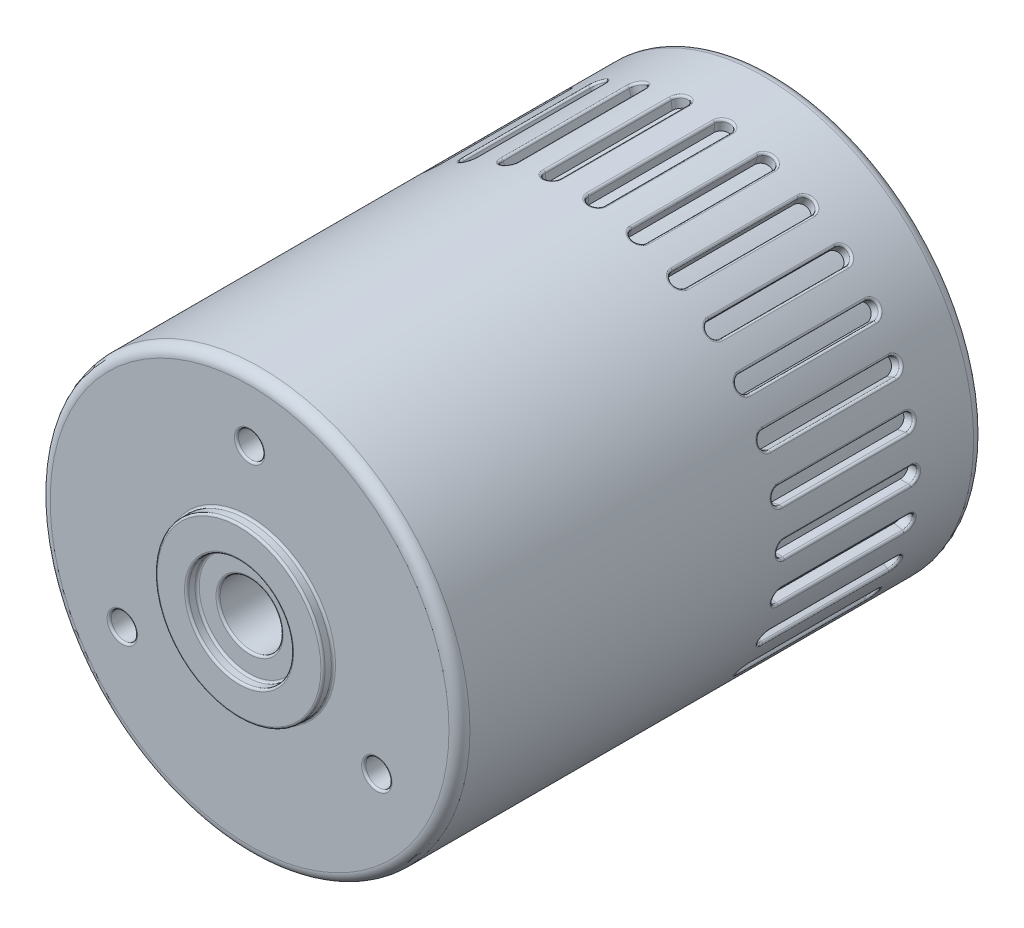
from build123d import *

# Parameters (mm, degrees)
SKETCH1_R                = 10
BOSS_EXTRUDE1_DEPTH      = 25
SKETCH2_R                = 4
SKETCH2_R_2              = 2.5
BOSS_EXTRUDE2_DEPTH      = 0.5
SKETCH3_R                = 1.5
BOSS_EXTRUDE3_DEPTH      = 0.5
CUT_EXTRUDE1_REACH       = 61.159
CUT_EXTRUDE1_END_RADIUS  = 10
CUT_EXTRUDE1_START       = 30
FILLET1_R                = 0.1
CIRPATTERN1_COUNT        = 30
FILLET1_OF_CIRPATTERN1_R = 0.1
SKETCH5_R                = 1.5
CUT_EXTRUDE2_DEPTH       = 5
FILLET2_R                = 0.5
SKETCH6_R                = 0.625
CUT_EXTRUDE3_DEPTH       = 5
FILLET3_R                = 0.1
FILLET4_R                = 0.1


with BuildPart() as part:
    # Sketch1 → Boss-Extrude1 (new body)
    with BuildSketch(Plane.XY):
        Circle(SKETCH1_R)
    extrude(amount=-BOSS_EXTRUDE1_DEPTH)

    # Sketch2 → Boss-Extrude2 (add)
    with BuildSketch(Plane.XY):
        Circle(SKETCH2_R)
        Circle(SKETCH2_R_2, mode=Mode.SUBTRACT)
    extrude(amount=BOSS_EXTRUDE2_DEPTH)

    # Sketch3 → Boss-Extrude3 (add)
    with BuildSketch(Plane(origin=(0, 0, -25), x_dir=(-1, 0, 0), z_dir=(0, 0, -1))):
        Circle(SKETCH3_R)
    extrude(amount=BOSS_EXTRUDE3_DEPTH)

    # Cut-Extrude1: up to this cylinder (the profile starts outside it)
    cut_extrude1_end = Plane(origin=(-0.5, 0, -18.5), z_dir=(0, 0, 1)) * Cylinder(CUT_EXTRUDE1_END_RADIUS, 143.318, mode=Mode.PRIVATE)
    # Sketch4 → Cut-Extrude1 (cut, up to the surface)
    with BuildSketch(Plane(origin=(0, 0, 0), x_dir=(0, 0, -1), z_dir=(1, 0, 0)).offset(CUT_EXTRUDE1_START), mode=Mode.PRIVATE) as cut_extrude1_sk1:
        with BuildLine():
            Line((15.5, 0.375), (21.5, 0.375))
            ThreePointArc((21.5, 0.375), (21.875, 0), (21.5, -0.375))
            Line((21.5, -0.375), (15.5, -0.375))
            ThreePointArc((15.5, -0.375), (15.125, 0), (15.5, 0.375))
        make_face()
    cut_extrude1_tool1 = extrude(cut_extrude1_sk1.sketch, amount=-CUT_EXTRUDE1_REACH, mode=Mode.PRIVATE) - cut_extrude1_end
    cut_extrude1 = cut_extrude1_tool1.solids().sort_by_distance((30, 0, -18.5))[0]
    add(cut_extrude1, mode=Mode.SUBTRACT)

    # Fillet1
    fillet1_edges = [part.edges().sort_by_distance(p)[0] for p in [
        (9.992966276, 0.375, -18.5),
        (9.996483757, 0.265165047, -21.765165036),
        (9.996483757, -0.265165047, -15.234834964),
        (9.992966276, -0.375, -18.5),
    ]]
    fillet(fillet1_edges, radius=FILLET1_R)

    # CirPattern1: Cut-Extrude1 ×30 about axis
    cirpattern1_axis = Axis((0, 0, -25), (0, 0, 1))
    for i in range(1, CIRPATTERN1_COUNT):
        add(cut_extrude1.rotate(cirpattern1_axis, i * 360 / CIRPATTERN1_COUNT), mode=Mode.SUBTRACT)

    # Fillet1 of CirPattern1
    fillet1_of_cirpattern1_edges = [part.edges().sort_by_distance(p)[0] for p in [
        (9.696629103, 2.444459865, -18.5),
        (9.72290569, 2.337756395, -21.765165036),
        (9.833167516, 1.819015285, -15.234834964),
        (9.852562871, 1.710849165, -18.5),
        (8.976502709, 4.407085104, -18.5),
        (9.024389988, 4.30817657, -21.765165036),
        (9.24009467, 3.823695922, -15.234834964),
        (9.281555191, 3.721926011, -18.5),
        (7.864060072, 6.177099577, -18.5),
        (7.931465139, 6.090308757, -21.765165036),
        (8.243185348, 5.661262698, -15.234834964),
        (8.304899011, 5.570336831, -18.5),
        (6.407920274, 7.677145157, -18.5),
        (6.491897205, 7.606265226, -21.765165036),
        (6.886009271, 7.251405128, -15.234834964),
        (6.965278893, 7.175297202, -18.5),
        (4.671723612, 8.841662654, -18.5),
        (4.768602211, 8.789791406, -21.765165036),
        (5.227881546, 8.524626359, -15.234834964),
        (5.321242665, 8.466662654, -18.5),
        (2.73135021, 9.619757067, -18.5),
        (2.836896419, 9.589161523, -21.765165036),
        (3.341270311, 9.425280511, -15.234834964),
        (3.444642597, 9.387994321, -18.5),
        (0.671603698, 9.977421935, -18.5),
        (0.78120464, 9.969439268, -21.765165036),
        (1.308629531, 9.914004678, -15.234834964),
        (1.417495119, 9.899025588, -18.5),
        (-1.417495119, 9.899025588, -18.5),
        (-1.308629531, 9.914004678, -21.765165036),
        (-0.78120464, 9.969439268, -15.234834964),
        (-0.671603698, 9.977421935, -18.5),
        (-3.444642597, 9.387994321, -18.5),
        (-3.341270311, 9.425280511, -21.765165036),
        (-2.836896419, 9.589161523, -15.234834964),
        (-2.73135021, 9.619757067, -18.5),
        (-5.321242665, 8.466662654, -18.5),
        (-5.227881546, 8.524626359, -21.765165036),
        (-4.768602211, 8.789791406, -15.234834964),
        (-4.671723612, 8.841662654, -18.5),
        (-6.965278893, 7.175297202, -18.5),
        (-6.886009271, 7.251405128, -21.765165036),
        (-6.491897205, 7.606265226, -15.234834964),
        (-6.407920274, 7.677145157, -18.5),
        (-8.304899011, 5.570336831, -18.5),
        (-8.243185348, 5.661262698, -21.765165036),
        (-7.931465139, 6.090308757, -15.234834964),
        (-7.864060072, 6.177099577, -18.5),
        (-9.281555191, 3.721926011, -18.5),
        (-9.24009467, 3.823695922, -21.765165036),
        (-9.024389988, 4.30817657, -15.234834964),
        (-8.976502709, 4.407085104, -18.5),
        (-9.852562871, 1.710849165, -18.5),
        (-9.833167516, 1.819015285, -21.765165036),
        (-9.72290569, 2.337756395, -15.234834964),
        (-9.696629103, 2.444459865, -18.5),
        (-9.992966276, -0.375, -18.5),
        (-9.996483757, -0.265165047, -21.765165036),
        (-9.996483757, 0.265165047, -15.234834964),
        (-9.992966276, 0.375, -18.5),
        (-9.696629103, -2.444459865, -18.5),
        (-9.72290569, -2.337756395, -21.765165036),
        (-9.833167516, -1.819015285, -15.234834964),
        (-9.852562871, -1.710849165, -18.5),
        (-8.976502709, -4.407085104, -18.5),
        (-9.024389988, -4.30817657, -21.765165036),
        (-9.24009467, -3.823695922, -15.234834964),
        (-9.281555191, -3.721926011, -18.5),
        (-7.864060072, -6.177099577, -18.5),
        (-7.931465139, -6.090308757, -21.765165036),
        (-8.243185348, -5.661262698, -15.234834964),
        (-8.304899011, -5.570336831, -18.5),
        (-6.407920274, -7.677145157, -18.5),
        (-6.491897205, -7.606265226, -21.765165036),
        (-6.886009271, -7.251405128, -15.234834964),
        (-6.965278893, -7.175297202, -18.5),
        (-4.671723612, -8.841662654, -18.5),
        (-4.768602211, -8.789791406, -21.765165036),
        (-5.227881546, -8.524626359, -15.234834964),
        (-5.321242665, -8.466662654, -18.5),
        (-2.73135021, -9.619757067, -18.5),
        (-2.836896419, -9.589161523, -21.765165036),
        (-3.341270311, -9.425280511, -15.234834964),
        (-3.444642597, -9.387994321, -18.5),
        (-0.671603698, -9.977421935, -18.5),
        (-0.78120464, -9.969439268, -21.765165036),
        (-1.308629531, -9.914004678, -15.234834964),
        (-1.417495119, -9.899025588, -18.5),
        (1.417495119, -9.899025588, -18.5),
        (1.308629531, -9.914004678, -21.765165036),
        (0.78120464, -9.969439268, -15.234834964),
        (0.671603698, -9.977421935, -18.5),
        (3.444642597, -9.387994321, -18.5),
        (3.341270311, -9.425280511, -21.765165036),
        (2.836896419, -9.589161523, -15.234834964),
        (2.73135021, -9.619757067, -18.5),
        (5.321242665, -8.466662654, -18.5),
        (5.227881546, -8.524626359, -21.765165036),
        (4.768602211, -8.789791406, -15.234834964),
        (4.671723612, -8.841662654, -18.5),
        (6.965278893, -7.175297202, -18.5),
        (6.886009271, -7.251405128, -21.765165036),
        (6.491897205, -7.606265226, -15.234834964),
        (6.407920274, -7.677145157, -18.5),
        (8.304899011, -5.570336831, -18.5),
        (8.243185348, -5.661262698, -21.765165036),
        (7.931465139, -6.090308757, -15.234834964),
        (7.864060072, -6.177099577, -18.5),
        (9.281555191, -3.721926011, -18.5),
        (9.24009467, -3.823695922, -21.765165036),
        (9.024389988, -4.30817657, -15.234834964),
        (8.976502709, -4.407085104, -18.5),
        (9.852562871, -1.710849165, -18.5),
        (9.833167516, -1.819015285, -21.765165036),
        (9.72290569, -2.337756395, -15.234834964),
        (9.696629103, -2.444459865, -18.5),
    ]]
    fillet(fillet1_of_cirpattern1_edges, radius=FILLET1_OF_CIRPATTERN1_R)

    # Sketch5 → Cut-Extrude2 (cut)
    with BuildSketch(Plane.XY):
        with Locations(Location((0, 0, 0), (0, 0, 180))):
            Circle(SKETCH5_R)
    extrude(amount=-CUT_EXTRUDE2_DEPTH, mode=Mode.SUBTRACT)

    # Fillet2
    fillet2_edges = [part.edges().sort_by_distance(p)[0] for p in [
        (-10, 0, 0),
        (-10, 0, -25),
    ]]
    fillet(fillet2_edges, radius=FILLET2_R)

    # Sketch6 → Cut-Extrude3 (cut)
    with BuildSketch(Plane.XY):
        with Locations((0, 7)):
            Circle(SKETCH6_R)
        with Locations((6.062177826, -3.5)):
            Circle(SKETCH6_R)
        with Locations((-6.062177826, -3.5)):
            Circle(SKETCH6_R)
    extrude(amount=-CUT_EXTRUDE3_DEPTH, mode=Mode.SUBTRACT)

    # Fillet3
    fillet3_edges = [part.edges().sort_by_distance(p)[0] for p in [
        (-2.5, 0, 0),
        (1.5, 0, 0),
        (-0.625, 7, -5),
        (-0.625, 7, 0),
        (5.437177826, -3.5, 0),
        (-6.687177826, -3.5, 0),
        (-4, 0, 0.5),
        (-4, 0, 0),
        (-2.5, 0, 0.5),
    ]]
    fillet(fillet3_edges, radius=FILLET3_R)

    # Fillet4
    fillet4_edges = [part.edges().sort_by_distance(p)[0] for p in [
        (1.5, 0, -25),
        (1.5, 0, -25.5),
    ]]
    fillet(fillet4_edges, radius=FILLET4_R)


solid = part.part
